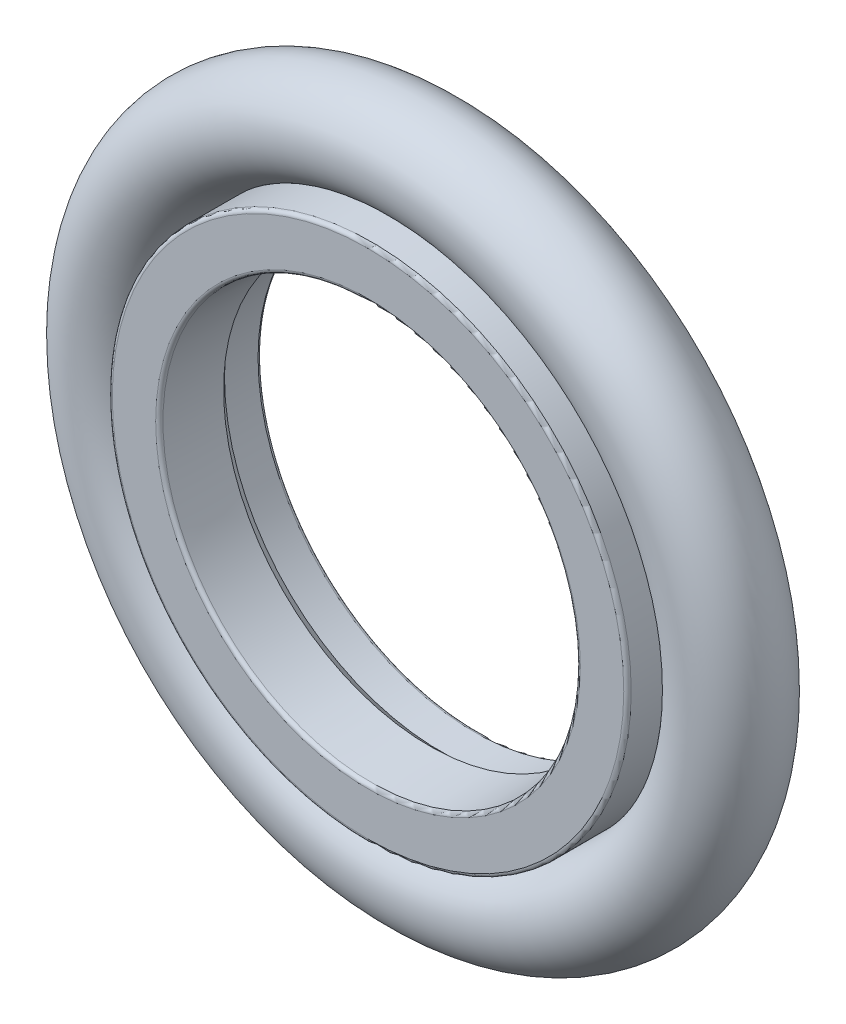
from build123d import *

# Parameters (mm, degrees)
SKETCH2_R = 1.3


with BuildPart() as part:
    # Sketch1 → Revolve1 (revolve)
    with BuildSketch(Plane(origin=(0, 0, 0), x_dir=(0, 0, -1), z_dir=(1, 0, 0))):
        with BuildLine():
            Line((0.1, 6.96), (2.85, 6.96))
            ThreePointArc((2.85, 6.96), (2.920710678, 6.930710678), (2.95, 6.86))
            Line((2.95, 6.86), (2.95, 5.9))
            ThreePointArc((2.95, 5.9), (2.920710678, 5.829289322), (2.85, 5.8))
            Line((2.85, 5.8), (1.95, 5.8))
            Line((1.95, 5.8), (1.65, 5.525))
            Line((1.65, 5.525), (0.095459234, 5.595660944))
            ThreePointArc((0.095459234, 5.595660944), (0.027701741, 5.626471173), (0, 5.695557798))
            Line((0, 5.695557798), (0, 6.86))
            ThreePointArc((0, 6.86), (0.029289322, 6.930710678), (0.1, 6.96))
        make_face()
    revolve(axis=Axis((0, 0, 0), (0, 0, -1)))


with BuildPart() as body_2:
    # Sketch2 → Revolve2 (revolve)
    with BuildSketch(Plane(origin=(0, 0, 0), x_dir=(0, 0, -1), z_dir=(1, 0, 0))):
        with Locations((1.475, 8.26)):
            Circle(SKETCH2_R)
    revolve(axis=Axis((0, 0, 0), (0, 0, -1)))


solid = Compound([part.part, body_2.part])
